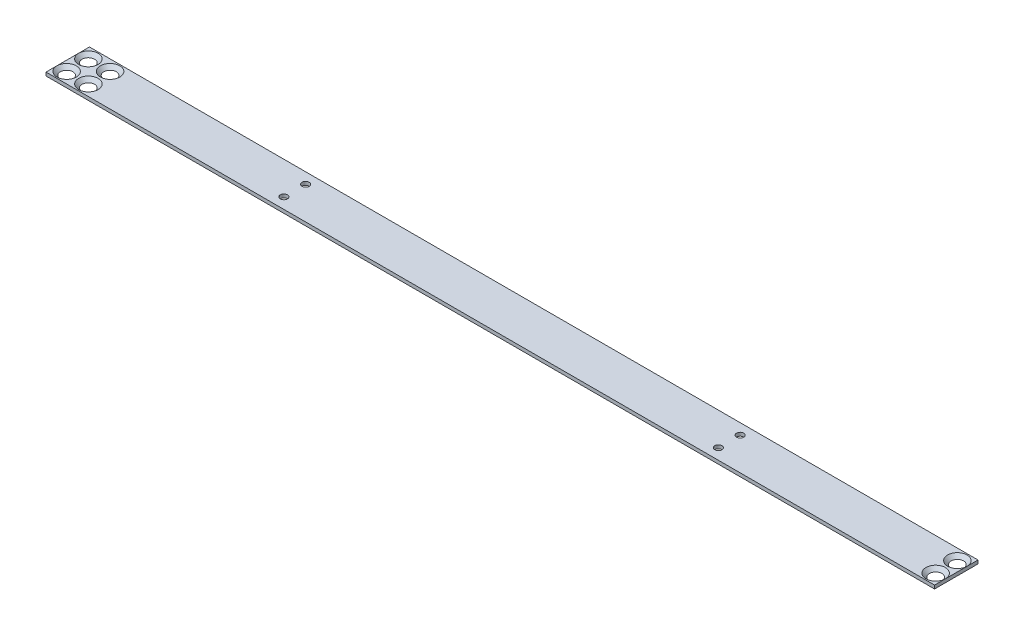
from build123d import *

# Parameters (mm, degrees)
SKETCH1_W                    = 409
SKETCH1_H                    = 20
BOSS_EXTRUDE1_DEPTH          = 1.5875
CSK_FOR_M4_SFHCS1_AT_2_COUNT = 2
CSK_FOR_M4_SFHCS1_AT_2_PITCH = 14.142135624
CSK_FOR_M4_SFHCS1_AT_3_COUNT = 2
CSK_FOR_M4_SFHCS1_AT_3_PITCH = 10
CSK_FOR_M4_SFHCS1_AT_4_COUNT = 2
CSK_FOR_M4_SFHCS1_AT_4_PITCH = 10
CSK_FOR_M4_SFHCS1_AT_5_COUNT = 2
CSK_FOR_M4_SFHCS1_AT_5_PITCH = 390
CSK_FOR_M4_SFHCS1_AT_6_COUNT = 2
CSK_FOR_M4_SFHCS1_AT_6_PITCH = 390.128184063
M4X0_7_TAPPED_HOLE1_D        = 3.3


with BuildPart() as part:
    # Sketch1 → Boss-Extrude1 (new body)
    with BuildSketch(Plane(origin=(0, 0, 0), x_dir=(1, 0, 0), z_dir=(0, 1, 0))):
        Rectangle(SKETCH1_W, SKETCH1_H)
    extrude(amount=BOSS_EXTRUDE1_DEPTH)

    # Sketch4 → CSK for M4 SFHCS1 (revolve, cut)
    with BuildSketch(Plane(origin=(-190, 1.5875, -5), x_dir=(0, 0, 1), z_dir=(1, 0, 0))):
        Polygon((0, 0), (0, 1.5875), (2.25, 1.5875), (2.25, 2.23), (4.48, 0), align=None)
    csk_for_m4_sfhcs1 = revolve(axis=Axis((-190, 7.9375, -5), (0, -1, 0)), mode=Mode.SUBTRACT)

    # CSK for M4 SFHCS1 at 2: CSK for M4 SFHCS1 ×2
    with Locations(*[Vector(-0.7071067811865472, 0, 0.7071067811865479) * (i * CSK_FOR_M4_SFHCS1_AT_2_PITCH) for i in range(1, CSK_FOR_M4_SFHCS1_AT_2_COUNT)]):
        add(csk_for_m4_sfhcs1, mode=Mode.SUBTRACT)

    # CSK for M4 SFHCS1 at 3: CSK for M4 SFHCS1 ×2
    with Locations(*[(-i * CSK_FOR_M4_SFHCS1_AT_3_PITCH, 0, 0) for i in range(1, CSK_FOR_M4_SFHCS1_AT_3_COUNT)]):
        add(csk_for_m4_sfhcs1, mode=Mode.SUBTRACT)

    # CSK for M4 SFHCS1 at 4: CSK for M4 SFHCS1 ×2
    with Locations(*[(0, 0, i * CSK_FOR_M4_SFHCS1_AT_4_PITCH) for i in range(1, CSK_FOR_M4_SFHCS1_AT_4_COUNT)]):
        add(csk_for_m4_sfhcs1, mode=Mode.SUBTRACT)

    # CSK for M4 SFHCS1 at 5: CSK for M4 SFHCS1 ×2
    with Locations(*[(i * CSK_FOR_M4_SFHCS1_AT_5_PITCH, 0, 0) for i in range(1, CSK_FOR_M4_SFHCS1_AT_5_COUNT)]):
        add(csk_for_m4_sfhcs1, mode=Mode.SUBTRACT)

    # CSK for M4 SFHCS1 at 6: CSK for M4 SFHCS1 ×2
    with Locations(*[Vector(0.9996714309094813, 0, 0.025632600792550815) * (i * CSK_FOR_M4_SFHCS1_AT_6_PITCH) for i in range(1, CSK_FOR_M4_SFHCS1_AT_6_COUNT)]):
        add(csk_for_m4_sfhcs1, mode=Mode.SUBTRACT)

    # M4x0.7 Tapped Hole1 (through all)
    with Locations(Plane(origin=(0, 1.5875, 0), x_dir=(1, 0, 0), z_dir=(0, 1, 0))):
        with Locations((100, 5), (-100, -5), (-100, 5), (100, -5)):
            Hole(M4X0_7_TAPPED_HOLE1_D / 2)


solid = part.part
